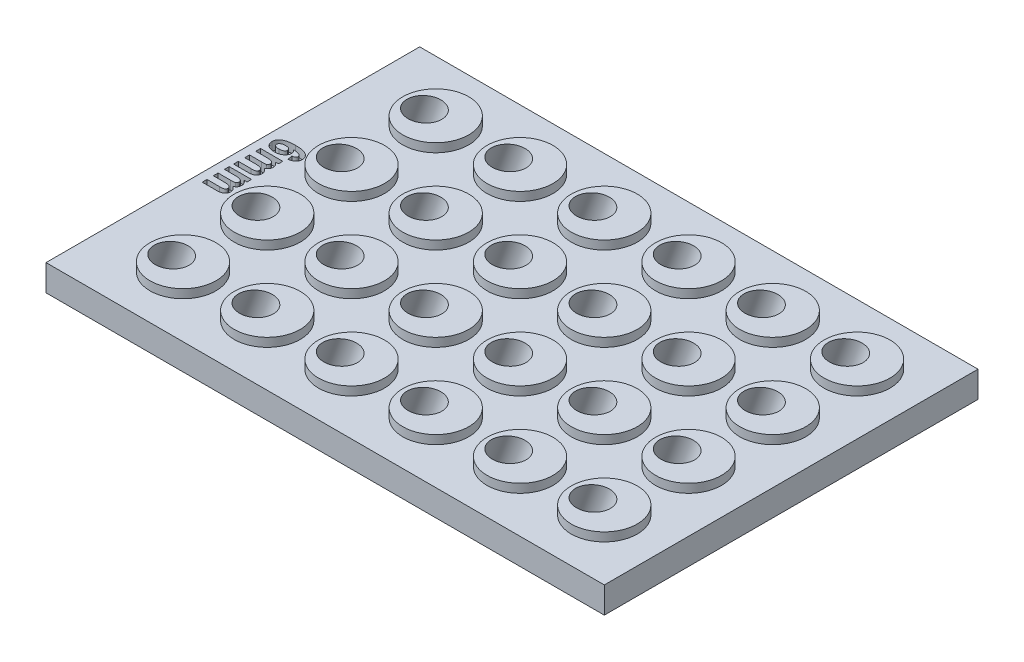
from build123d import *

# Parameters (mm, degrees)
SKETCH1_W           = 127.89
SKETCH1_H           = 85.6
MAIN_PLATE_DEPTH    = 6
WELLS_LSP_R         = 7.56
BOSS_EXTRUDE1_DEPTH = 2
LPATTERN1_START     = -19.125363412
LPATTERN1_OUTLINE_R = 3.75
LPATTERN1_DEPTH     = 44.248142968
CUT_EXTRUDE1_DEPTH  = 2


# Read off the part's stored shape, not the designer's step: LPattern1
with BuildPart() as part:
    # Sketch1 → Main Plate (new body)
    with BuildSketch(Plane(origin=(0, 0, 0), x_dir=(1, 0, 0), z_dir=(0, 1, 0))):
        Rectangle(SKETCH1_W, SKETCH1_H)
    extrude(amount=MAIN_PLATE_DEPTH)

    # Wells_LSP → Boss-Extrude1 (add)
    with BuildSketch(Plane(origin=(0, 6, 0), x_dir=(1, 0, 0), z_dir=(0, 1, 0))):
        with Locations(Location((-46.425, 28.96, 0), (0, 0, 270))):
            Circle(WELLS_LSP_R)
        with Locations(Location((-27.125, 28.96, 0), (0, 0, 270))):
            Circle(WELLS_LSP_R)
        with Locations(Location((-7.825, 28.96, 0), (0, 0, 270))):
            Circle(WELLS_LSP_R)
        with Locations(Location((11.475, 28.96, 0), (0, 0, 270))):
            Circle(WELLS_LSP_R)
        with Locations(Location((30.775, 28.96, 0), (0, 0, 270))):
            Circle(WELLS_LSP_R)
        with Locations(Location((50.075, 28.96, 0), (0, 0, 270))):
            Circle(WELLS_LSP_R)
        with Locations(Location((-27.125, 9.66, 0), (0, 0, 270))):
            Circle(WELLS_LSP_R)
        with Locations(Location((-7.825, 9.66, 0), (0, 0, 270))):
            Circle(WELLS_LSP_R)
        with Locations(Location((11.475, 9.66, 0), (0, 0, 270))):
            Circle(WELLS_LSP_R)
        with Locations(Location((30.775, 9.66, 0), (0, 0, 270))):
            Circle(WELLS_LSP_R)
        with Locations(Location((50.075, 9.66, 0), (0, 0, 270))):
            Circle(WELLS_LSP_R)
        with Locations(Location((-27.125, -9.64, 0), (0, 0, 270))):
            Circle(WELLS_LSP_R)
        with Locations(Location((-7.825, -9.64, 0), (0, 0, 270))):
            Circle(WELLS_LSP_R)
        with Locations(Location((11.475, -9.64, 0), (0, 0, 270))):
            Circle(WELLS_LSP_R)
        with Locations(Location((30.775, -9.64, 0), (0, 0, 270))):
            Circle(WELLS_LSP_R)
        with Locations(Location((50.075, -9.64, 0), (0, 0, 270))):
            Circle(WELLS_LSP_R)
        with Locations(Location((-27.125, -28.94, 0), (0, 0, 270))):
            Circle(WELLS_LSP_R)
        with Locations(Location((-7.825, -28.94, 0), (0, 0, 270))):
            Circle(WELLS_LSP_R)
        with Locations(Location((11.475, -28.94, 0), (0, 0, 270))):
            Circle(WELLS_LSP_R)
        with Locations(Location((30.775, -28.94, 0), (0, 0, 270))):
            Circle(WELLS_LSP_R)
        with Locations(Location((50.075, -28.94, 0), (0, 0, 270))):
            Circle(WELLS_LSP_R)
        with Locations(Location((-46.425, 9.66, 0), (0, 0, 270))):
            Circle(WELLS_LSP_R)
        with Locations(Location((-46.425, -9.64, 0), (0, 0, 270))):
            Circle(WELLS_LSP_R)
        with Locations(Location((-46.425, -28.94, 0), (0, 0, 270))):
            Circle(WELLS_LSP_R)
    extrude(amount=BOSS_EXTRUDE1_DEPTH)

    # Sketch2 → Cut-Revolve1 (revolve, cut)
    with BuildSketch(Plane(origin=(0, 0, -28.96), x_dir=(-1, 0, 0), z_dir=(0, 0, -1)), mode=Mode.PRIVATE) as cut_revolve1_sk:
        Polygon((43.841673572, 22.217424463), (47.3655209, 23.5), (55.918821406, 0), (52.394974078, -1.282575537), align=None)
    revolve(cut_revolve1_sk.sketch.rotate(Axis((-43.841673572, 22.217424463, -28.96), (-0.3420201433256694, -0.9396926207859082, 0)), 180), axis=Axis((-43.841673572, 22.217424463, -28.96), (-0.3420201433256694, -0.9396926207859082, 0)), mode=Mode.SUBTRACT)

    # LPattern1 outline → LPattern1 (cut)
    with BuildSketch(Plane(origin=(0, 0, 0), x_dir=(0.9396926207859082, -0.3420201433256691, 0), z_dir=(0.3420201433256691, 0.9396926207859083, 0)).offset(LPATTERN1_START)):
        with Locations((-30.660436257, 28.96)):
            Circle(LPATTERN1_OUTLINE_R)
        with Locations((-12.524368676, 28.96)):
            Circle(LPATTERN1_OUTLINE_R)
        with Locations((5.611698906, 28.96)):
            Circle(LPATTERN1_OUTLINE_R)
        with Locations((23.747766487, 28.96)):
            Circle(LPATTERN1_OUTLINE_R)
        with Locations((41.883834068, 28.96)):
            Circle(LPATTERN1_OUTLINE_R)
        with Locations((-48.796503838, 9.66)):
            Circle(LPATTERN1_OUTLINE_R)
        with Locations((-30.660436257, 9.66)):
            Circle(LPATTERN1_OUTLINE_R)
        with Locations((-12.524368676, 9.66)):
            Circle(LPATTERN1_OUTLINE_R)
        with Locations((5.611698906, 9.66)):
            Circle(LPATTERN1_OUTLINE_R)
        with Locations((23.747766487, 9.66)):
            Circle(LPATTERN1_OUTLINE_R)
        with Locations((41.883834068, 9.66)):
            Circle(LPATTERN1_OUTLINE_R)
        with Locations((-48.796503838, -9.64)):
            Circle(LPATTERN1_OUTLINE_R)
        with Locations((-30.660436257, -9.64)):
            Circle(LPATTERN1_OUTLINE_R)
        with Locations((-12.524368676, -9.64)):
            Circle(LPATTERN1_OUTLINE_R)
        with Locations((5.611698906, -9.64)):
            Circle(LPATTERN1_OUTLINE_R)
        with Locations((23.747766487, -9.64)):
            Circle(LPATTERN1_OUTLINE_R)
        with Locations((41.883834068, -9.64)):
            Circle(LPATTERN1_OUTLINE_R)
        with Locations((-48.796503838, -28.94)):
            Circle(LPATTERN1_OUTLINE_R)
        with Locations((-30.660436257, -28.94)):
            Circle(LPATTERN1_OUTLINE_R)
        with Locations((-12.524368676, -28.94)):
            Circle(LPATTERN1_OUTLINE_R)
        with Locations((5.611698906, -28.94)):
            Circle(LPATTERN1_OUTLINE_R)
        with Locations((23.747766487, -28.94)):
            Circle(LPATTERN1_OUTLINE_R)
        with Locations((41.883834068, -28.94)):
            Circle(LPATTERN1_OUTLINE_R)
    extrude(amount=LPATTERN1_DEPTH, mode=Mode.SUBTRACT)

    # Sketch3 → Cut-Extrude1 (cut)
    # profile 1 of 3: a face of its own
    with BuildSketch(Plane(origin=(0, 6, 0), x_dir=(1, 0, 0), z_dir=(0, 1, 0))):
        with BuildLine():
            Line((-56.731072257, 5.409090909), (-56.912890439, 6.5))
            add(Edge.make_bspline(
                [(-56.912890439, 6.5), (-56.848754865, 6.507160681), (-56.72796693, 6.520646549), (-56.56047781, 6.560192719), (-56.417656996, 6.613160299), (-56.300493906, 6.681573851), (-56.206765303, 6.763700377), (-56.141754586, 6.862980945), (-56.100987931, 6.976613067), (-56.096857287, 7.057405463), (-56.094708621, 7.099431818)],
                knots=[0, 0, 0, 0, 1.373534822, 2.586808301, 3.656255023, 4.605807111, 5.462623692, 6.284975384, 7.107883449, 8, 8, 8, 8], degree=3))
            add(Edge.make_bspline(
                [(-56.094708621, 7.099431818), (-56.095617152, 7.127486244), (-56.097408923, 7.18281407), (-56.117301088, 7.263553824), (-56.147140948, 7.34126874), (-56.189734876, 7.415524739), (-56.246836807, 7.483977735), (-56.314059868, 7.549523281), (-56.392663465, 7.612385605), (-56.485461687, 7.67187712), (-56.597314698, 7.726246312), (-56.731646277, 7.776225511), (-56.891730839, 7.816390269), (-57.075059429, 7.857623835), (-57.284612512, 7.888333403), (-57.518502347, 7.917051654), (-57.77720298, 7.939497691), (-57.957838828, 7.949385812), (-58.052094984, 7.954545455)],
                knots=[0, 0, 0, 0, 0.576990169, 1.137917149, 1.703239646, 2.288990578, 2.892433666, 3.534106501, 4.221341408, 4.962944926, 5.800749476, 6.77943051, 7.910748907, 9.198722595, 10.650465757, 12.272170328, 14.054810806, 16, 16, 16, 16], degree=3))
            add(Edge.make_bspline(
                [(-58.052094984, 7.954545455), (-58.005002948, 7.920874283), (-57.913712886, 7.855601181), (-57.792238573, 7.746000091), (-57.690442226, 7.629665314), (-57.605547706, 7.508702989), (-57.53924654, 7.38081576), (-57.491647259, 7.246163833), (-57.464674452, 7.104288993), (-57.460471498, 7.007684503), (-57.458344984, 6.958806818)],
                knots=[0, 0, 0, 0, 1.147521788, 2.224523334, 3.235995272, 4.207625523, 5.148408325, 6.08392744, 7.030550333, 8, 8, 8, 8], degree=3))
            add(Edge.make_bspline(
                [(-57.458344984, 6.958806818), (-57.460412211, 6.904728745), (-57.464520831, 6.797248392), (-57.492697332, 6.638696267), (-57.544105098, 6.486681662), (-57.612453787, 6.33899984), (-57.701451843, 6.197023992), (-57.808644904, 6.059093953), (-57.937669904, 5.929151752), (-58.083234605, 5.804786957), (-58.24429731, 5.689401328), (-58.420957602, 5.590451057), (-58.609933186, 5.506547816), (-58.810950069, 5.435883274), (-59.025927754, 5.384794279), (-59.253192528, 5.3464532), (-59.492820713, 5.321308679), (-59.657144282, 5.319238462), (-59.741015439, 5.318181818)],
                knots=[0, 0, 0, 0, 0.832283334, 1.654165928, 2.467606077, 3.295667843, 4.153060879, 5.040790556, 5.978637068, 6.965831481, 7.9848927, 9.022517391, 10.076113705, 11.163856565, 12.296745883, 13.471966313, 14.709685334, 16, 16, 16, 16], degree=3))
            add(Edge.make_bspline(
                [(-59.741015439, 5.318181818), (-59.830565427, 5.31981348), (-60.004794602, 5.322988053), (-60.258196644, 5.347676619), (-60.496907246, 5.386341415), (-60.720148781, 5.444192474), (-60.930961408, 5.513694931), (-61.125085895, 5.604305967), (-61.30620481, 5.707412655), (-61.468716068, 5.828765441), (-61.615070473, 5.960616683), (-61.744023821, 6.101270151), (-61.851943404, 6.250880914), (-61.941618037, 6.407083543), (-62.010385331, 6.571732), (-62.057955865, 6.744598044), (-62.089312801, 6.924531496), (-62.092894113, 7.047215781), (-62.094708621, 7.109375)],
                knots=[0, 0, 0, 0, 1.298090761, 2.525575823, 3.687990512, 4.800185422, 5.866079674, 6.901223397, 7.900863476, 8.882546267, 9.835189119, 10.753655296, 11.643454654, 12.50428952, 13.359742743, 14.222546109, 15.099435223, 16, 16, 16, 16], degree=3))
            add(Edge.make_bspline(
                [(-62.094708621, 7.109375), (-62.092355706, 7.177751283), (-62.087709636, 7.312767216), (-62.047658363, 7.509895705), (-61.985107704, 7.69903181), (-61.894942389, 7.877947699), (-61.779159945, 8.048157571), (-61.637899626, 8.208331205), (-61.471164044, 8.359512428), (-61.2798247, 8.502789588), (-61.058407287, 8.633216921), (-60.802412506, 8.742706213), (-60.51510079, 8.83799263), (-60.193404811, 8.912896727), (-59.839709408, 8.974216114), (-59.452037759, 9.015238221), (-59.031616973, 9.04106282), (-58.740109861, 9.043955381), (-58.589026803, 9.045454545)],
                knots=[0, 0, 0, 0, 0.734880277, 1.451095922, 2.154962096, 2.872480545, 3.598606755, 4.363803828, 5.164164342, 6.015782743, 6.931263278, 7.921113567, 9.005098047, 10.183655502, 11.470683431, 12.864488494, 14.374919009, 16, 16, 16, 16], degree=3))
            add(Edge.make_bspline(
                [(-58.589026803, 9.045454545), (-58.43557853, 9.044027963), (-58.139315681, 9.041273657), (-57.711647607, 9.014426678), (-57.317214147, 8.969178262), (-56.956173486, 8.908526951), (-56.628724881, 8.827098569), (-56.333771407, 8.730639856), (-56.071516676, 8.614964859), (-55.844259718, 8.47852728), (-55.646305545, 8.329709141), (-55.474861746, 8.170185793), (-55.328465878, 8.000793193), (-55.20917469, 7.820506901), (-55.117428214, 7.629637704), (-55.051780175, 7.428641839), (-55.010475805, 7.217124054), (-55.006047326, 7.072160025), (-55.00379953, 6.998579545)],
                knots=[0, 0, 0, 0, 1.596518637, 3.082401342, 4.456168422, 5.726182561, 6.888816875, 7.96380488, 8.951761247, 9.864275317, 10.715608241, 11.524304739, 12.296474716, 13.039816174, 13.766981747, 14.492994826, 15.235078085, 16, 16, 16, 16], degree=3))
            add(Edge.make_bspline(
                [(-55.00379953, 6.998579545), (-55.005223128, 6.94784932), (-55.008028199, 6.847890011), (-55.028407362, 6.701415587), (-55.060775913, 6.560833788), (-55.107951567, 6.426497158), (-55.169564004, 6.298292291), (-55.243905361, 6.17568932), (-55.330517184, 6.058327754), (-55.432363082, 5.949358423), (-55.545310093, 5.845938859), (-55.675155305, 5.755330491), (-55.817070682, 5.672755301), (-55.973367838, 5.600613603), (-56.142390957, 5.535952149), (-56.326804585, 5.484763927), (-56.523867752, 5.439940506), (-56.660829985, 5.419548914), (-56.731072257, 5.409090909)],
                knots=[0, 0, 0, 0, 0.938429574, 1.849090387, 2.730978085, 3.6037676, 4.477611741, 5.358062252, 6.253423895, 7.171011581, 8.113928736, 9.081433186, 10.094207076, 11.148493307, 12.263080455, 13.438792911, 14.68646268, 16, 16, 16, 16], degree=3))
        make_face()
        with BuildLine():
            add(Edge.make_bspline(
                [(-59.696981348, 7.863636364), (-59.748127116, 7.862587002), (-59.847672167, 7.860544628), (-59.992921278, 7.85140129), (-60.128559191, 7.832839308), (-60.255510601, 7.807579073), (-60.372063674, 7.773435818), (-60.48052111, 7.734044083), (-60.578709107, 7.685309204), (-60.667637214, 7.630577475), (-60.746137919, 7.570507377), (-60.81429385, 7.507964872), (-60.873199153, 7.444436919), (-60.920760521, 7.378067894), (-60.95861683, 7.30973833), (-60.98373951, 7.238065824), (-61.000264259, 7.165043372), (-61.002621251, 7.115617491), (-61.00379953, 7.090909091)],
                knots=[0, 0, 0, 0, 1.467063455, 2.855346856, 4.170798216, 5.390463327, 6.563664699, 7.650722887, 8.695222878, 9.701329085, 10.641009281, 11.525189072, 12.351817551, 13.120543733, 13.861795579, 14.583384742, 15.291822527, 16, 16, 16, 16], degree=3))
            add(Edge.make_bspline(
                [(-61.00379953, 7.090909091), (-61.000812455, 7.043490184), (-60.994910668, 6.949801096), (-60.938172322, 6.817544172), (-60.84787632, 6.699662928), (-60.746944467, 6.61477858), (-60.64874761, 6.555575885), (-60.561687574, 6.515609012), (-60.462580335, 6.484032699), (-60.353777784, 6.455177199), (-60.233562134, 6.434029549), (-60.102485264, 6.421084341), (-59.960420911, 6.410009132), (-59.861779438, 6.409404506), (-59.810617712, 6.409090909)],
                knots=[0, 0, 0, 0, 1.10939644, 2.191917695, 3.319954251, 4.574866243, 5.263603829, 6.010279106, 6.819397753, 7.704415383, 8.653663817, 9.683155171, 10.79833729, 12, 12, 12, 12], degree=3))
            add(Edge.make_bspline(
                [(-59.810617712, 6.409090909), (-59.757572846, 6.409499865), (-59.655168457, 6.410289366), (-59.507186172, 6.420138638), (-59.370702758, 6.437339933), (-59.24477008, 6.459485836), (-59.130338198, 6.489059333), (-59.026558827, 6.524618704), (-58.933705793, 6.566661833), (-58.82907327, 6.63173091), (-58.718746611, 6.722065713), (-58.620855218, 6.848961661), (-58.559017272, 6.990535965), (-58.552527053, 7.090309715), (-58.549254075, 7.140625)],
                knots=[0, 0, 0, 0, 1.176453253, 2.271171319, 3.287245332, 4.22660609, 5.105423138, 5.905880325, 6.657735779, 7.360218118, 8.634991581, 9.796584371, 10.888831116, 12, 12, 12, 12], degree=3))
            add(Edge.make_bspline(
                [(-58.549254075, 7.140625), (-58.552842269, 7.189435193), (-58.560000965, 7.286814927), (-58.617463204, 7.425459416), (-58.710601568, 7.550774294), (-58.815405868, 7.64055417), (-58.914496211, 7.705358518), (-59.000396242, 7.747993073), (-59.094908405, 7.783006674), (-59.197716293, 7.813449089), (-59.310080562, 7.835157609), (-59.430902832, 7.852520314), (-59.560924523, 7.862443416), (-59.650563327, 7.86322937), (-59.696981348, 7.863636364)],
                knots=[0, 0, 0, 0, 1.160949793, 2.316175707, 3.519822443, 4.855974483, 5.582526876, 6.339918642, 7.136761333, 7.98355107, 8.893612599, 9.862824193, 10.893297682, 12, 12, 12, 12], degree=3))
        make_face(mode=Mode.SUBTRACT)
    # profile 2 of 3: a face of its own
    with BuildSketch(Plane(origin=(0, 6, 0), x_dir=(1, 0, 0), z_dir=(0, 1, 0))):
        with BuildLine():
            Line((-56.912890439, 4.409090909), (-56.912890439, 3.409090909))
            Line((-56.912890439, 3.409090909), (-57.607492712, 3.409090909))
            add(Edge.make_bspline(
                [(-57.607492712, 3.409090909), (-57.543116398, 3.362940642), (-57.419041386, 3.273993412), (-57.254299345, 3.125793027), (-57.117584129, 2.970014214), (-57.008528907, 2.806941178), (-56.925172299, 2.637085904), (-56.864881169, 2.461158463), (-56.828116844, 2.278044496), (-56.824035958, 2.15357562), (-56.821981348, 2.090909091)],
                knots=[0, 0, 0, 0, 1.18585077, 2.285537003, 3.311018897, 4.282753788, 5.215288273, 6.137107824, 7.062086912, 8, 8, 8, 8], degree=3))
            add(Edge.make_bspline(
                [(-56.821981348, 2.090909091), (-56.824457113, 2.024936578), (-56.829271835, 1.896637083), (-56.866122467, 1.71071691), (-56.93152536, 1.539805345), (-57.019814098, 1.381286333), (-57.135925839, 1.238358128), (-57.275321541, 1.106955031), (-57.442789975, 0.992135756), (-57.567370087, 0.929856749), (-57.631640439, 0.897727273)],
                knots=[0, 0, 0, 0, 1.032363716, 2.007680752, 2.950610311, 3.886464362, 4.835606831, 5.82137184, 6.876054961, 8, 8, 8, 8], degree=3))
            add(Edge.make_bspline(
                [(-57.631640439, 0.897727273), (-57.567443193, 0.850886136), (-57.443356463, 0.760346996), (-57.275905299, 0.61337145), (-57.13683566, 0.458115544), (-57.021884033, 0.299080188), (-56.93310729, 0.1341301), (-56.867121725, -0.035203134), (-56.82982347, -0.211443732), (-56.824599555, -0.330802709), (-56.821981348, -0.390625)],
                knots=[0, 0, 0, 0, 1.202740909, 2.324775499, 3.365275479, 4.351815561, 5.288261977, 6.19346422, 7.094570761, 8, 8, 8, 8], degree=3))
            add(Edge.make_bspline(
                [(-56.821981348, -0.390625), (-56.824207442, -0.460437099), (-56.828529321, -0.595974729), (-56.868625347, -0.791296276), (-56.929984495, -0.972812634), (-57.020917622, -1.137029541), (-57.13434081, -1.284483766), (-57.268698999, -1.415723738), (-57.427501524, -1.524936876), (-57.575531863, -1.601250693), (-57.707853903, -1.651548554), (-57.821353993, -1.684386557), (-57.947390863, -1.710305983), (-58.08621279, -1.733212916), (-58.237366456, -1.751497348), (-58.401811878, -1.764168754), (-58.578554746, -1.770807133), (-58.700764209, -1.772074274), (-58.763742712, -1.772727273)],
                knots=[0, 0, 0, 0, 1.23071008, 2.389378461, 3.50465438, 4.600411856, 5.685152553, 6.778453708, 7.900502651, 9.074022523, 9.708788861, 10.396364239, 11.156854391, 11.978390981, 12.879114841, 13.843054262, 14.888455842, 16, 16, 16, 16], degree=3))
            Line((-58.763742712, -1.772727273), (-62.00379953, -1.772727273))
            Line((-62.00379953, -1.772727273), (-62.00379953, -0.681818182))
            Line((-62.00379953, -0.681818182), (-59.089026803, -0.681818182))
            add(Edge.make_bspline(
                [(-59.089026803, -0.681818182), (-59.027945769, -0.681039532), (-58.911439952, -0.679554336), (-58.744630091, -0.674796867), (-58.59394238, -0.663439588), (-58.459033731, -0.647439937), (-58.339573268, -0.630526452), (-58.236644789, -0.606108312), (-58.149294781, -0.578409915), (-58.056028768, -0.536146763), (-57.960562024, -0.467806945), (-57.877817638, -0.358557414), (-57.829381142, -0.22438115), (-57.824540782, -0.127782788), (-57.821981348, -0.076704545)],
                knots=[0, 0, 0, 0, 1.383466805, 2.638821246, 3.778719439, 4.804235443, 5.715712558, 6.509016418, 7.19739627, 7.787565388, 8.823512243, 9.818640032, 10.846563945, 12, 12, 12, 12], degree=3))
            add(Edge.make_bspline(
                [(-57.821981348, -0.076704545), (-57.822972553, -0.045360845), (-57.824910433, 0.015918443), (-57.843092559, 0.104990587), (-57.869744958, 0.18975185), (-57.908276808, 0.269787527), (-57.959001931, 0.344432223), (-58.020635476, 0.414490851), (-58.093714412, 0.479402372), (-58.17718828, 0.542034202), (-58.277389565, 0.599267184), (-58.399429541, 0.643722371), (-58.540446241, 0.685837849), (-58.703286829, 0.717106342), (-58.886315969, 0.742245613), (-59.09058563, 0.76085645), (-59.315748061, 0.769676096), (-59.473017402, 0.771682287), (-59.554935894, 0.772727273)],
                knots=[0, 0, 0, 0, 0.69688417, 1.362460852, 2.015740612, 2.670972873, 3.33160781, 4.018699962, 4.7425581, 5.50352258, 6.338874527, 7.299879275, 8.387136119, 9.612850157, 10.985619131, 12.498984496, 14.17639021, 16, 16, 16, 16], degree=3))
            Line((-59.554935894, 0.772727273), (-62.00379953, 0.772727273))
            Line((-62.00379953, 0.772727273), (-62.00379953, 1.863636364))
            Line((-62.00379953, 1.863636364), (-59.209765439, 1.863636364))
            add(Edge.make_bspline(
                [(-59.209765439, 1.863636364), (-59.143473891, 1.863866243), (-59.017031197, 1.864304709), (-58.837087778, 1.868713837), (-58.675495629, 1.874924419), (-58.532557866, 1.886938817), (-58.40740602, 1.899119477), (-58.300911121, 1.913658152), (-58.213193605, 1.933521071), (-58.161854634, 1.949977819), (-58.138742712, 1.957386364)],
                knots=[0, 0, 0, 0, 1.474579857, 2.812573463, 4.003904225, 5.071012922, 6.002702754, 6.801087064, 7.460270018, 8, 8, 8, 8], degree=3))
            add(Edge.make_bspline(
                [(-58.138742712, 1.957386364), (-58.113795863, 1.968590631), (-58.06510389, 1.990459441), (-57.999503471, 2.032911442), (-57.943869558, 2.083553968), (-57.899592961, 2.143249288), (-57.863377159, 2.209897737), (-57.840076596, 2.285753275), (-57.823382848, 2.368111025), (-57.822458701, 2.426042433), (-57.821981348, 2.455965909)],
                knots=[0, 0, 0, 0, 1.035565722, 2.02124684, 2.948493026, 3.87103721, 4.82651521, 5.808430736, 6.867982454, 8, 8, 8, 8], degree=3))
            add(Edge.make_bspline(
                [(-57.821981348, 2.455965909), (-57.823701941, 2.497377817), (-57.827115234, 2.579530274), (-57.860608439, 2.699415403), (-57.912047914, 2.814038159), (-57.983423142, 2.922399225), (-58.074716306, 3.021360592), (-58.187387882, 3.105302799), (-58.318003314, 3.175131756), (-58.44121022, 3.220172751), (-58.553547007, 3.247222451), (-58.652367128, 3.267678022), (-58.765040117, 3.281822012), (-58.890808012, 3.297237974), (-59.030711048, 3.306010996), (-59.184132004, 3.313235402), (-59.350841496, 3.317437412), (-59.466392195, 3.317927018), (-59.526526803, 3.318181818)],
                knots=[0, 0, 0, 0, 0.924341018, 1.833696853, 2.762757941, 3.72619197, 4.72287041, 5.758618708, 6.853174813, 8.025793947, 8.680773075, 9.436781179, 10.281493003, 11.21944483, 12.270510512, 13.415497155, 14.654979434, 16, 16, 16, 16], degree=3))
            Line((-59.526526803, 3.318181818), (-62.00379953, 3.318181818))
            Line((-62.00379953, 3.318181818), (-62.00379953, 4.409090909))
            Line((-62.00379953, 4.409090909), (-56.912890439, 4.409090909))
        make_face()
    # profile 3 of 3: a face of its own
    with BuildSketch(Plane(origin=(0, 6, 0), x_dir=(1, 0, 0), z_dir=(0, 1, 0))):
        with BuildLine():
            Line((-56.912890439, -2.772727273), (-56.912890439, -3.772727273))
            Line((-56.912890439, -3.772727273), (-57.607492712, -3.772727273))
            add(Edge.make_bspline(
                [(-57.607492712, -3.772727273), (-57.543116398, -3.818877539), (-57.419041386, -3.90782477), (-57.254299345, -4.056025155), (-57.117584129, -4.211803968), (-57.008528907, -4.374877003), (-56.925172299, -4.544732278), (-56.864881169, -4.720659719), (-56.828116844, -4.903773686), (-56.824035958, -5.028242562), (-56.821981348, -5.090909091)],
                knots=[0, 0, 0, 0, 1.18585077, 2.285537003, 3.311018897, 4.282753788, 5.215288273, 6.137107824, 7.062086912, 8, 8, 8, 8], degree=3))
            add(Edge.make_bspline(
                [(-56.821981348, -5.090909091), (-56.824457113, -5.156881603), (-56.829271835, -5.285181098), (-56.866122467, -5.471101271), (-56.93152536, -5.642012837), (-57.019814098, -5.800531848), (-57.135925839, -5.943460054), (-57.275321541, -6.074863151), (-57.442789975, -6.189682426), (-57.567370087, -6.251961433), (-57.631640439, -6.284090909)],
                knots=[0, 0, 0, 0, 1.032363716, 2.007680752, 2.950610311, 3.886464362, 4.835606831, 5.82137184, 6.876054961, 8, 8, 8, 8], degree=3))
            add(Edge.make_bspline(
                [(-57.631640439, -6.284090909), (-57.567443193, -6.330932046), (-57.443356463, -6.421471186), (-57.275905299, -6.568446731), (-57.13683566, -6.723702638), (-57.021884033, -6.882737993), (-56.93310729, -7.047688082), (-56.867121725, -7.217021316), (-56.82982347, -7.393261913), (-56.824599555, -7.512620891), (-56.821981348, -7.572443182)],
                knots=[0, 0, 0, 0, 1.202740909, 2.324775499, 3.365275479, 4.351815561, 5.288261977, 6.19346422, 7.094570761, 8, 8, 8, 8], degree=3))
            add(Edge.make_bspline(
                [(-56.821981348, -7.572443182), (-56.824207442, -7.642255281), (-56.828529321, -7.777792911), (-56.868625347, -7.973114458), (-56.929984495, -8.154630816), (-57.020917622, -8.318847723), (-57.13434081, -8.466301948), (-57.268698999, -8.59754192), (-57.427501524, -8.706755058), (-57.575531863, -8.783068875), (-57.707853903, -8.833366736), (-57.821353993, -8.866204739), (-57.947390863, -8.892124165), (-58.08621279, -8.915031098), (-58.237366456, -8.93331553), (-58.401811878, -8.945986936), (-58.578554746, -8.952625315), (-58.700764209, -8.953892456), (-58.763742712, -8.954545455)],
                knots=[0, 0, 0, 0, 1.23071008, 2.389378461, 3.50465438, 4.600411856, 5.685152553, 6.778453708, 7.900502651, 9.074022523, 9.708788861, 10.396364239, 11.156854391, 11.978390981, 12.879114841, 13.843054262, 14.888455842, 16, 16, 16, 16], degree=3))
            Line((-58.763742712, -8.954545455), (-62.00379953, -8.954545455))
            Line((-62.00379953, -8.954545455), (-62.00379953, -7.863636364))
            Line((-62.00379953, -7.863636364), (-59.089026803, -7.863636364))
            add(Edge.make_bspline(
                [(-59.089026803, -7.863636364), (-59.027945769, -7.862857714), (-58.911439952, -7.861372518), (-58.744630091, -7.856615049), (-58.59394238, -7.84525777), (-58.459033731, -7.829258119), (-58.339573268, -7.812344634), (-58.236644789, -7.787926494), (-58.149294781, -7.760228097), (-58.056028768, -7.717964945), (-57.960562024, -7.649625127), (-57.877817638, -7.540375596), (-57.829381142, -7.406199331), (-57.824540782, -7.30960097), (-57.821981348, -7.258522727)],
                knots=[0, 0, 0, 0, 1.383466805, 2.638821246, 3.778719439, 4.804235443, 5.715712558, 6.509016418, 7.19739627, 7.787565388, 8.823512243, 9.818640032, 10.846563945, 12, 12, 12, 12], degree=3))
            add(Edge.make_bspline(
                [(-57.821981348, -7.258522727), (-57.822972553, -7.227179027), (-57.824910433, -7.165899739), (-57.843092559, -7.076827594), (-57.869744958, -6.992066332), (-57.908276808, -6.912030655), (-57.959001931, -6.837385958), (-58.020635476, -6.76732733), (-58.093714412, -6.70241581), (-58.17718828, -6.63978398), (-58.277389565, -6.582550998), (-58.399429541, -6.538095811), (-58.540446241, -6.495980333), (-58.703286829, -6.46471184), (-58.886315969, -6.439572569), (-59.09058563, -6.420961732), (-59.315748061, -6.412142086), (-59.473017402, -6.410135894), (-59.554935894, -6.409090909)],
                knots=[0, 0, 0, 0, 0.69688417, 1.362460852, 2.015740612, 2.670972873, 3.33160781, 4.018699962, 4.7425581, 5.50352258, 6.338874527, 7.299879275, 8.387136119, 9.612850157, 10.985619131, 12.498984496, 14.17639021, 16, 16, 16, 16], degree=3))
            Line((-59.554935894, -6.409090909), (-62.00379953, -6.409090909))
            Line((-62.00379953, -6.409090909), (-62.00379953, -5.318181818))
            Line((-62.00379953, -5.318181818), (-59.209765439, -5.318181818))
            add(Edge.make_bspline(
                [(-59.209765439, -5.318181818), (-59.143473891, -5.317951939), (-59.017031197, -5.317513472), (-58.837087778, -5.313104345), (-58.675495629, -5.306893763), (-58.532557866, -5.294879364), (-58.40740602, -5.282698705), (-58.300911121, -5.26816003), (-58.213193605, -5.248297111), (-58.161854634, -5.231840363), (-58.138742712, -5.224431818)],
                knots=[0, 0, 0, 0, 1.474579857, 2.812573463, 4.003904225, 5.071012922, 6.002702754, 6.801087064, 7.460270018, 8, 8, 8, 8], degree=3))
            add(Edge.make_bspline(
                [(-58.138742712, -5.224431818), (-58.113795863, -5.213227551), (-58.06510389, -5.191358741), (-57.999503471, -5.14890674), (-57.943869558, -5.098264214), (-57.899592961, -5.038568893), (-57.863377159, -4.971920444), (-57.840076596, -4.896064907), (-57.823382848, -4.813707157), (-57.822458701, -4.755775749), (-57.821981348, -4.725852273)],
                knots=[0, 0, 0, 0, 1.035565722, 2.02124684, 2.948493026, 3.87103721, 4.82651521, 5.808430736, 6.867982454, 8, 8, 8, 8], degree=3))
            add(Edge.make_bspline(
                [(-57.821981348, -4.725852273), (-57.823701941, -4.684440365), (-57.827115234, -4.602287908), (-57.860608439, -4.482402779), (-57.912047914, -4.367780023), (-57.983423142, -4.259418957), (-58.074716306, -4.16045759), (-58.187387882, -4.076515383), (-58.318003314, -4.006686426), (-58.44121022, -3.96164543), (-58.553547007, -3.93459573), (-58.652367128, -3.914140159), (-58.765040117, -3.89999617), (-58.890808012, -3.884580208), (-59.030711048, -3.875807186), (-59.184132004, -3.868582779), (-59.350841496, -3.86438077), (-59.466392195, -3.863891163), (-59.526526803, -3.863636364)],
                knots=[0, 0, 0, 0, 0.924341018, 1.833696853, 2.762757941, 3.72619197, 4.72287041, 5.758618708, 6.853174813, 8.025793947, 8.680773075, 9.436781179, 10.281493003, 11.21944483, 12.270510512, 13.415497155, 14.654979434, 16, 16, 16, 16], degree=3))
            Line((-59.526526803, -3.863636364), (-62.00379953, -3.863636364))
            Line((-62.00379953, -3.863636364), (-62.00379953, -2.772727273))
            Line((-62.00379953, -2.772727273), (-56.912890439, -2.772727273))
        make_face()
    extrude(amount=-CUT_EXTRUDE1_DEPTH, mode=Mode.SUBTRACT)


solid = part.part
